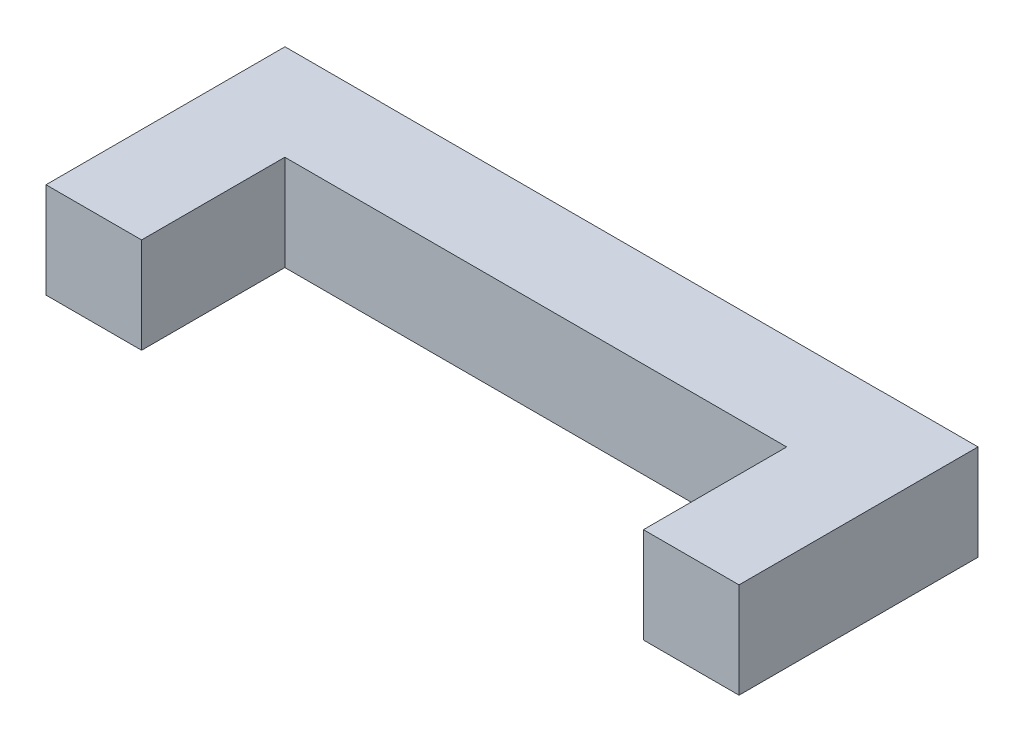
from build123d import *

# Parameters (mm, degrees)
CUT_EXTRUDE1_DEPTH     = 5
CUT_EXTRUDE3_DEPTH     = 45
SKETCH8_R              = 40
CUT_EXTRUDE4_DEPTH     = 32
FILLET1_R              = 7
CUT_REVOLVE1_START     = 17
CUT_REVOLVE1_DEPTH     = 30.5
SKETCH18_W             = 13
SKETCH18_H             = 8
CUT_EXTRUDE13_DEPTH    = 5
SKETCH20_W             = 84
SKETCH20_H             = 7
CUT_EXTRUDE15_DEPTH    = 5
SKETCH19_R             = 1.5
CUT_EXTRUDE14_DEPTH    = 12
FILLET3_R              = 4
SKETCH21_W             = 16
SKETCH21_H             = 5
CUT_EXTRUDE16_DEPTH    = 5
CIRPATTERN1_COUNT      = 4
SKETCH22_W             = 5
SKETCH22_H             = 12
BOSS_EXTRUDE1_DEPTH    = 1.5
SKETCH23_W             = 5
SKETCH23_H             = 4.4
SKETCH23_H_2           = 4
BOSS_EXTRUDE2_DEPTH    = 17
SKETCH24_W             = 2
SKETCH24_H             = 3
BOSS_EXTRUDE3_DEPTH    = 2
CIRPATTERN2_COUNT      = 5
CUT_REVOLVE2_START     = 17
CUT_REVOLVE2_DEPTH     = 30.5
SKETCH29_W             = 16.2
SKETCH29_H             = 11.2
SKETCH29_W_2           = 13
SKETCH29_H_2           = 8
BOSS_EXTRUDE4_DEPTH    = 20
CUT_EXTRUDE18_DEPTH    = 12
SKETCH34_R             = 2.3
BOSS_EXTRUDE5_DEPTH    = 3.5
BOSS_EXTRUDE6_START    = 3.5
SKETCH35_R             = 2.3
BOSS_EXTRUDE6_DEPTH    = 3.5
SKETCH36_W             = 2
SKETCH36_H             = 2
BOSS_EXTRUDE7_DEPTH    = 5
SKETCH37_W             = 2
SKETCH37_H             = 2
BOSS_EXTRUDE8_DEPTH    = 12.5
SKETCH40_W             = 2
SKETCH40_H             = 2
BOSS_EXTRUDE9_DEPTH    = 5
INTERSECT7_START       = -43
INTERSECT7_OUTLINE_W   = 16.2
INTERSECT7_OUTLINE_H   = 20
INTERSECT7_OUTLINE_R   = 2.3
INTERSECT7_DEPTH       = 86
INTERSECT7_START_2     = -35.6
INTERSECT7_2_OUTLINE_W = 16.2
INTERSECT7_2_OUTLINE_H = 20
INTERSECT7_2_OUTLINE_R = 2.3
INTERSECT7_2_DEPTH     = 37.6


with BuildPart() as part:
    # Sketch1 → Revolve1 (revolve)
    with BuildSketch(Plane.XY, mode=Mode.PRIVATE) as revolve1_sk:
        with BuildLine():
            Line((37, 55), (0, 55))
            Line((0, 55), (0, 11.5))
            Line((0, 11.5), (22.5, 11.5))
            Line((22.5, 11.5), (22.5, 0))
            Line((22.5, 0), (25, 0))
            Line((25, 0), (25, 11.5))
            Line((25, 11.5), (42, 11.5))
            Line((42, 11.5), (42, 50))
            ThreePointArc((42, 50), (40.535533906, 53.535533906), (37, 55))
        make_face()
    revolve(revolve1_sk.sketch.rotate(Axis((0, 2, 0), (0, 1, 0)), 90), axis=Axis((0, 2, 0), (0, 1, 0)))

    # Sketch5 → Cut-Extrude1 (cut)
    with BuildSketch(Plane(origin=(0, 55, 0), x_dir=(1, 0, 0), z_dir=(0, 1, 0))):
        with BuildLine():
            Line((-42, 0), (-40, 0))
            Line((-40, 0), (40, 0))
            Line((40, 0), (42, 0))
            ThreePointArc((42, 0), (0, 42), (-42, 0))
        make_face()
    extrude(amount=-CUT_EXTRUDE1_DEPTH, mode=Mode.SUBTRACT)

    # Sketch7 → Cut-Extrude3 (cut)
    with BuildSketch(Plane.XZ.offset(-11.5)):
        with BuildLine():
            Line((21, 0), (-21, 0))
            ThreePointArc((-21, 0), (-18.277714988, -10.340461055), (-10.816653826, -18))
            Line((-10.816653826, -18), (10.816653826, -18))
            ThreePointArc((10.816653826, -18), (18.277714988, -10.340461055), (21, 0))
        make_face()
    extrude(amount=-CUT_EXTRUDE3_DEPTH, mode=Mode.SUBTRACT)

    # Sketch8 → Cut-Extrude4 (cut)
    with BuildSketch(Plane(origin=(0, 47.5, 0), x_dir=(1, 0, 0), z_dir=(0, 1, 0))):
        with Locations(Location((0, 0, 0), (0, 0, 270))):
            Circle(SKETCH8_R)
        with BuildLine():
            Line((22.912878475, -2), (-22.981606036, -2))
            ThreePointArc((-22.981606036, -2), (-20.067855169, 10.855581536), (-10.573881727, 20))
            Line((-10.573881727, 20), (10.505154166, 20))
            ThreePointArc((10.505154166, 20), (19.999127608, 10.855581536), (22.912878475, -2))
        make_face(mode=Mode.SUBTRACT)
    extrude(amount=-CUT_EXTRUDE4_DEPTH, mode=Mode.SUBTRACT)

    # Fillet1
    fillet1_edges = [part.edges().sort_by_distance(p)[0] for p in [
        (-21, 30.75, 0),
        (21, 30.75, 0),
    ]]
    fillet(fillet1_edges, radius=FILLET1_R)

    # Cut-Revolve1: read off the stored shape, not the designer's step
    # Cut-Revolve1 outline → Cut-Revolve1 (cut)
    with BuildSketch(Plane(origin=(0, 0, 0), x_dir=(1, 0, 0), z_dir=(0, 1, 0)).offset(CUT_REVOLVE1_START)):
        with BuildLine():
            Line((-34.641016151, -20), (-36.373066959, -21))
            ThreePointArc((-36.373066959, -21), (0, -42), (36.373066959, -21))
            Line((36.373066959, -21), (34.641016151, -20))
            ThreePointArc((34.641016151, -20), (0, -40), (-34.641016151, -20))
        make_face()
    extrude(amount=CUT_REVOLVE1_DEPTH, mode=Mode.SUBTRACT)

    # Sketch18 → Cut-Extrude13 (cut)
    with BuildSketch(Plane(origin=(0, 50, 0), x_dir=(1, 0, 0), z_dir=(0, 1, 0))):
        with Locations((0, 30)):
            Rectangle(SKETCH18_W, SKETCH18_H)
    extrude(amount=-CUT_EXTRUDE13_DEPTH, mode=Mode.SUBTRACT)

    # Sketch20 → Cut-Extrude15 (cut)
    with BuildSketch(Plane(origin=(0, 55, 0), x_dir=(1, 0, 0), z_dir=(0, 1, 0))):
        with Locations((0, -3.5)):
            Rectangle(SKETCH20_W, SKETCH20_H)
    extrude(amount=-CUT_EXTRUDE15_DEPTH, mode=Mode.SUBTRACT)

    # Sketch19 → Cut-Extrude14 (cut)
    with BuildSketch(Plane(origin=(0, 0, 7), x_dir=(-1, 0, 0), z_dir=(0, 0, -1))):
        with Locations((0, 52.5)):
            Circle(SKETCH19_R)
        with Locations((-29.412558482, 52.5)):
            Circle(SKETCH19_R)
        with Locations((29.412558482, 52.5)):
            Circle(SKETCH19_R)
    extrude(amount=-CUT_EXTRUDE14_DEPTH, mode=Mode.SUBTRACT)

    # Fillet3
    fillet3_edges = [part.edges().sort_by_distance(p)[0] for p in [
        (0, 11.5, 42),
    ]]
    fillet(fillet3_edges, radius=FILLET3_R)

    # Sketch21 → Cut-Extrude16 (cut)
    with BuildSketch(Plane(origin=(0, 15.5, 0), x_dir=(1, 0, 0), z_dir=(0, 1, 0))):
        with Locations((0, -29.5)):
            Rectangle(SKETCH21_W, SKETCH21_H)
    cut_extrude16 = extrude(amount=-CUT_EXTRUDE16_DEPTH, mode=Mode.SUBTRACT)

    # CirPattern1: Cut-Extrude16 ×4 about axis
    cirpattern1_axis = Axis((0, 0, 0), (0, 1, 0))
    for i in range(1, CIRPATTERN1_COUNT):
        add(cut_extrude16.rotate(cirpattern1_axis, i * 360 / CIRPATTERN1_COUNT), mode=Mode.SUBTRACT)

    # Sketch22 → Boss-Extrude1 (add)
    with BuildSketch(Plane(origin=(0, 15.5, 0), x_dir=(1, 0, 0), z_dir=(0, 1, 0))):
        with Locations((35.5, -4)):
            Rectangle(SKETCH22_W, SKETCH22_H)
    extrude(amount=BOSS_EXTRUDE1_DEPTH)

    # Sketch23 → Boss-Extrude2 (add)
    with BuildSketch(Plane(origin=(0, 17, 0), x_dir=(1, 0, 0), z_dir=(0, 1, 0))):
        with Locations((35.5, -0.2)):
            Rectangle(SKETCH23_W, SKETCH23_H)
        with Locations((35.5, -8)):
            Rectangle(SKETCH23_W, SKETCH23_H_2)
    extrude(amount=BOSS_EXTRUDE2_DEPTH)

    # Sketch24 → Boss-Extrude3 (add)
    with BuildSketch(Plane.XZ):
        with Locations((0, -22.5)):
            Rectangle(SKETCH24_W, SKETCH24_H)
    boss_extrude3 = extrude(amount=-BOSS_EXTRUDE3_DEPTH)

    # CirPattern2: Boss-Extrude3 ×5 about axis
    cirpattern2_axis = Axis((0, 0, 0), (0, 1, 0))
    for i in range(1, CIRPATTERN2_COUNT):
        add(boss_extrude3.rotate(cirpattern2_axis, i * 360 / CIRPATTERN2_COUNT))

    # Cut-Revolve2: read off the stored shape, not the designer's step
    # Cut-Revolve2 outline → Cut-Revolve2 (cut)
    with BuildSketch(Plane(origin=(0, 0, 0), x_dir=(1, 0, 0), z_dir=(0, 1, 0)).offset(CUT_REVOLVE2_START)):
        with BuildLine():
            ThreePointArc((-30.641777725, 25.711504387), (0, 40), (30.641777725, 25.711504387))
            Line((30.641777725, 25.711504387), (32.173866611, 26.997079607))
            ThreePointArc((32.173866611, 26.997079607), (0, 42), (-32.173866611, 26.997079607))
            Line((-32.173866611, 26.997079607), (-30.641777725, 25.711504387))
        make_face()
    extrude(amount=CUT_REVOLVE2_DEPTH, mode=Mode.SUBTRACT)

    # Sketch29 → Boss-Extrude4 (add)
    with BuildSketch(Plane.XZ.offset(-47.5)):
        with Locations((0, -30)):
            Rectangle(SKETCH29_W, SKETCH29_H)
        with Locations((0, -30)):
            Rectangle(SKETCH29_W_2, SKETCH29_H_2, mode=Mode.SUBTRACT)
    extrude(amount=BOSS_EXTRUDE4_DEPTH)

    # Sketch32 → Cut-Extrude18 (cut)
    with BuildSketch(Plane(origin=(0, 0, -35.6), x_dir=(-1, 0, 0), z_dir=(0, 0, -1))):
        with BuildLine():
            Line((-4.55, 40.24987133), (-4.55, 41.2))
            ThreePointArc((-4.55, 41.2), (-4.258194078, 41.946205288), (-3.537595761, 42.296506718))
            ThreePointArc((-3.537595761, 42.296506718), (0, 45.55), (3.537595761, 42.296506718))
            ThreePointArc((3.537595761, 42.296506718), (4.258194078, 41.946205288), (4.55, 41.2))
            Line((4.55, 41.2), (4.55, 40.675870248))
            ThreePointArc((4.55, 40.675870248), (4.010824187, 37.38705417), (2.4497454, 34.442558497))
            ThreePointArc((2.4497454, 34.442558497), (1.613339464, 32.35352404), (1.966232927, 30.131114075))
            ThreePointArc((1.966232927, 30.131114075), (1.891748397, 29.932488662), (1.693122984, 30.006973192))
            ThreePointArc((1.693122984, 30.006973192), (1.315208372, 32.386958334), (2.210917864, 34.624111266))
            ThreePointArc((2.210917864, 34.624111266), (3.726528337, 37.48284493), (4.25, 40.675870248))
            Line((4.25, 40.675870248), (4.25, 41.2))
            ThreePointArc((4.25, 41.2), (4.015685425, 41.765685425), (3.45, 42))
            Line((3.45, 42), (3.25, 42))
            ThreePointArc((3.25, 42), (0, 45.25), (-3.25, 42))
            Line((-3.25, 42), (-3.45, 42))
            ThreePointArc((-3.45, 42), (-4.015685425, 41.765685425), (-4.25, 41.2))
            Line((-4.25, 41.2), (-4.25, 40.24987133))
            ThreePointArc((-4.25, 40.24987133), (-3.782078371, 37.22671372), (-2.422103613, 34.486476277))
            ThreePointArc((-2.422103613, 34.486476277), (-1.704952932, 32.326507722), (-2.304950317, 30.131109718))
            ThreePointArc((-2.304950317, 30.131109718), (-2.51173821, 30.0837941), (-2.559053827, 30.290581992))
            ThreePointArc((-2.559053827, 30.290581992), (-2.00484446, 32.318441057), (-2.667266721, 34.313574426))
            ThreePointArc((-2.667266721, 34.313574426), (-4.068040722, 37.136018992), (-4.55, 40.24987133))
        make_face()
    extrude(amount=-CUT_EXTRUDE18_DEPTH, mode=Mode.SUBTRACT)

    # Sketch34 → Boss-Extrude5 (add)
    with BuildSketch(Plane.XY.offset(-34)):
        with Locations(Location((0, 42, 0), (0, 0, 180))):
            Circle(SKETCH34_R)
    extrude(amount=BOSS_EXTRUDE5_DEPTH)

    # Sketch35 → Boss-Extrude6 (add)
    with BuildSketch(Plane(origin=(0, 0, -26), x_dir=(-1, 0, 0), z_dir=(0, 0, -1)).offset(BOSS_EXTRUDE6_START)):
        with Locations((0, 42)):
            Circle(SKETCH35_R)
    extrude(amount=-BOSS_EXTRUDE6_DEPTH)

    # Sketch36 → Boss-Extrude7 (add)
    with BuildSketch(Plane(origin=(0, 0, -35.6), x_dir=(-1, 0, 0), z_dir=(0, 0, -1))):
        with Locations((-6.159647943, 37.918102195)):
            Rectangle(SKETCH36_W, SKETCH36_H)
    extrude(amount=BOSS_EXTRUDE7_DEPTH)

    # Sketch37 → Boss-Extrude8 (add)
    with BuildSketch(Plane.ZY.offset(-5.159647943)):
        with Locations((-39.597351245, 37.918102195)):
            Rectangle(SKETCH37_W, SKETCH37_H)
    extrude(amount=BOSS_EXTRUDE8_DEPTH)

    # Sketch40 → Boss-Extrude9 (add)
    with BuildSketch(Plane(origin=(0, 0, -35.6), x_dir=(-1, 0, 0), z_dir=(0, 0, -1))):
        with Locations((6.340352057, 37.918102195)):
            Rectangle(SKETCH40_W, SKETCH40_H)
    extrude(amount=BOSS_EXTRUDE9_DEPTH)

    # Intersect7: read off the stored shape, not the designer's step
    # Intersect7 outline → Intersect7 (cut)
    # profile 1 of 2: a face of its own
    with BuildSketch(Plane.XY.offset(INTERSECT7_START)):
        Polygon((44, 55), (-44, 55), (-44, 11.5), (-27, 11.5), (-27, 0), (27, 0), (27, 11.5), (44, 11.5), align=None)
        with Locations((0, 37.5)):
            Rectangle(INTERSECT7_OUTLINE_W, INTERSECT7_OUTLINE_H, mode=Mode.SUBTRACT)
    # profile 2 of 2: a face of its own
    with BuildSketch(Plane.XY.offset(INTERSECT7_START)):
        with Locations((0, 42)):
            Circle(INTERSECT7_OUTLINE_R)
    extrude(amount=INTERSECT7_DEPTH, mode=Mode.SUBTRACT)

    # Intersect7 2 outline → Intersect7 2 (cut)
    with BuildSketch(Plane.XY.offset(INTERSECT7_START_2)):
        with Locations((0, 37.5)):
            Rectangle(INTERSECT7_2_OUTLINE_W, INTERSECT7_2_OUTLINE_H)
        with Locations((0, 42)):
            Circle(INTERSECT7_2_OUTLINE_R, mode=Mode.SUBTRACT)
    extrude(amount=INTERSECT7_2_DEPTH, mode=Mode.SUBTRACT)


solid = part.part
